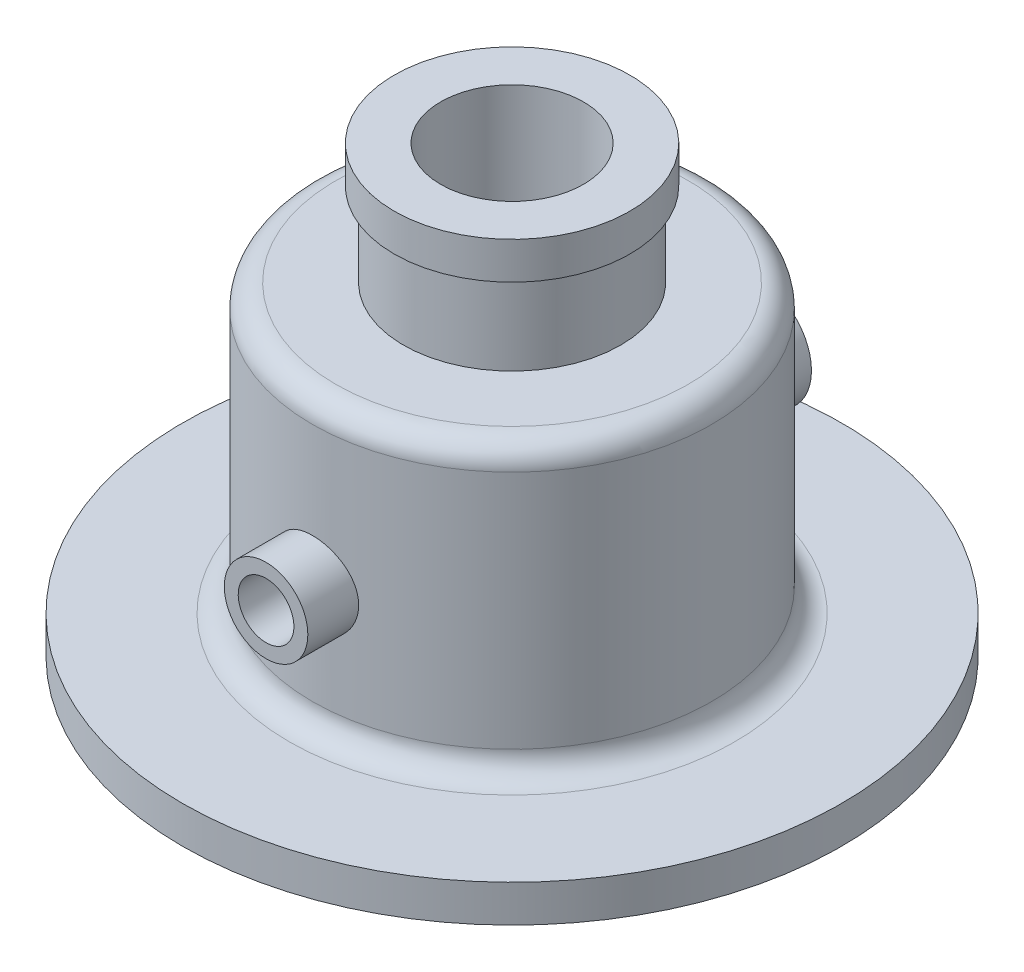
from build123d import *
from build123d.topology import SkipClean

# Parameters (mm, degrees)
CROQUIS2_R              = 71
CROQUIS2_R_2            = 25
SALIENTE_EXTRUIR2_DEPTH = 8
CROQUIS6_R              = 32
CROQUIS6_R_2            = 25
SALIENTE_EXTRUIR3_DEPTH = 18
REDONDEO1_R             = 2
CROQUIS7_R              = 43
CROQUIS7_R_2            = 35
EXTRUIR_L_MINA2_DEPTH   = 61.7
REDONDEO2_R             = 5
SALIENTE_EXTRUIR6_START = -8
CROQUIS16_R             = 43
SALIENTE_EXTRUIR6_DEPTH = 8
REDONDEO4_R             = 5
CROQUIS17_R             = 23.4
CROQUIS17_R_2           = 15.4
EXTRUIR_L_MINA3_DEPTH   = 18
CROQUIS18_R             = 25.4
SALIENTE_EXTRUIR7_DEPTH = 8
CROQUIS19_R             = 15.4
CORTAR_EXTRUIR3_DEPTH   = 60
CROQUIS20_W             = 75.22649233
CROQUIS20_H             = 104.996756407
CORTAR_EXTRUIR4_DEPTH   = 75
REDONDEO6_R             = 5
REVOLUCI_N4_ANGLE       = 180
SALIENTE_EXTRUIR8_DEPTH = 13
CORTAR_EXTRUIR5_DEPTH   = 6.5
SALIENTE_EXTRUIR9_DEPTH = 13
CROQUIS27_R             = 6
CORTAR_EXTRUIR7_DEPTH   = 6.5


with BuildPart() as part:
    # Croquis2 → Saliente-Extruir2 (new body)
    with BuildSketch(Plane(origin=(0, 0, 0), x_dir=(1, 0, 0), z_dir=(0, 1, 0))):
        with Locations(Location((0, 0, 0), (0, 0, 270))):
            Circle(CROQUIS2_R)
        with Locations(Location((0, 0, 0), (0, 0, 270))):
            Circle(CROQUIS2_R_2, mode=Mode.SUBTRACT)
    extrude(amount=SALIENTE_EXTRUIR2_DEPTH)

    # Croquis6 → Saliente-Extruir3 (add)
    with BuildSketch(Plane(origin=(0, -5, 0), x_dir=(1, 0, 0), z_dir=(0, 1, 0))):
        with Locations(Location((0, 0, 0), (0, 0, 270))):
            Circle(CROQUIS6_R)
        with Locations(Location((0, 0, 0), (0, 0, 270))):
            Circle(CROQUIS6_R_2, mode=Mode.SUBTRACT)
    extrude(amount=SALIENTE_EXTRUIR3_DEPTH)

    # Redondeo1
    redondeo1_edges = [part.edges().sort_by_distance(p)[0] for p in [
        (0, 0, -32),
    ]]
    fillet(redondeo1_edges, radius=REDONDEO1_R)

    # Croquis7 → Extruir-Lámina2 (add)
    with BuildSketch(Plane(origin=(0, 8, 0), x_dir=(1, 0, 0), z_dir=(0, 1, 0))):
        Circle(CROQUIS7_R)
        Circle(CROQUIS7_R_2, mode=Mode.SUBTRACT)
    extrude(amount=EXTRUIR_L_MINA2_DEPTH)

    # Redondeo2
    redondeo2_edges = [part.edges().sort_by_distance(p)[0] for p in [
        (-43, 8, 0),
    ]]
    fillet(redondeo2_edges, radius=REDONDEO2_R)

    # Redondeo3: read off the stored shape, not the designer's step
    # Redondeo3 outline → Redondeo3 (revolve)
    with BuildSketch(Plane.XY):
        with BuildLine():
            Line((30, 13), (32, 13))
            Line((32, 13), (32, 8))
            Line((32, 8), (35, 8))
            Line((35, 8), (35, 18))
            ThreePointArc((35, 18), (33.535533906, 14.464466094), (30, 13))
        make_face()
    revolve(axis=Axis((0, 0, 0), (0, 1, 0)))

    # Croquis16 → Saliente-Extruir6 (add)
    with BuildSketch(Plane(origin=(0, 69.7, 0), x_dir=(1, 0, 0), z_dir=(0, 1, 0)).offset(SALIENTE_EXTRUIR6_START)):
        Circle(CROQUIS16_R)
    extrude(amount=SALIENTE_EXTRUIR6_DEPTH)

    # Redondeo4
    redondeo4_edges = [part.edges().sort_by_distance(p)[0] for p in [
        (-43, 69.7, 0),
    ]]
    fillet(redondeo4_edges, radius=REDONDEO4_R)

    # Croquis17 → Extruir-Lámina3 (add)
    with BuildSketch(Plane(origin=(0, 69.7, 0), x_dir=(1, 0, 0), z_dir=(0, 1, 0))):
        Circle(CROQUIS17_R)
        Circle(CROQUIS17_R_2, mode=Mode.SUBTRACT)
    extrude(amount=EXTRUIR_L_MINA3_DEPTH)

    # Croquis18 → Saliente-Extruir7 (add)
    with BuildSketch(Plane(origin=(0, 87.7, 0), x_dir=(1, 0, 0), z_dir=(0, 1, 0))):
        with Locations(Location((0, 0, 0), (0, 0, 270))):
            Circle(CROQUIS18_R)
    extrude(amount=SALIENTE_EXTRUIR7_DEPTH)

    # Croquis19 → Cortar-Extruir3 (cut, symmetric)
    with SkipClean():  # the faces are left unmerged after this step: merging them gives an invalid solid
        with BuildSketch(Plane(origin=(0, 95.7, 0), x_dir=(1, 0, 0), z_dir=(0, 1, 0))):
            with Locations(Location((0, 0, 0), (0, 0, 270))):
                Circle(CROQUIS19_R)
        extrude(amount=CORTAR_EXTRUIR3_DEPTH, both=True, mode=Mode.SUBTRACT)

    # Croquis20 → Cortar-Extruir4 (cut, symmetric)
    with BuildSketch(Plane.XY):
        with Locations((37.613246165, 47.498378204)):
            Rectangle(CROQUIS20_W, CROQUIS20_H)
    extrude(amount=CORTAR_EXTRUIR4_DEPTH, both=True, mode=Mode.SUBTRACT)

    # Redondeo6
    redondeo6_edges = [part.edges().sort_by_distance(p)[0] for p in [
        (-35, 61.7, 0),
    ]]
    fillet(redondeo6_edges, radius=REDONDEO6_R)

    # Croquis21 → Revolución4 (revolve)
    with BuildSketch(Plane(origin=(0, 0, 0), x_dir=(0, 0, -1), z_dir=(1, 0, 0))):
        Polygon((-15.4, 61.7), (-17.4, 59.7), (-25.4, 59.7), (-25.4, 61.7), align=None)
    revolve(axis=Axis((0, 0, 0), (0, -1, 0)), revolution_arc=REVOLUCI_N4_ANGLE)

    # Croquis22 → Saliente-Extruir8 (add)
    with BuildSketch(Plane.XY.offset(-40)):
        with BuildLine():
            Line((0, 44), (0, 40))
            ThreePointArc((0, 40), (-7.5, 32.5), (0, 25))
            Line((0, 25), (0, 21))
            ThreePointArc((0, 21), (-11.5, 32.5), (0, 44))
        make_face()
    extrude(amount=-SALIENTE_EXTRUIR8_DEPTH)

    # Croquis24 → Cortar-Extruir5 (cut, symmetric)
    with BuildSketch(Plane.XY.offset(-40)):
        with BuildLine():
            Line((0, 40), (0, 25))
            ThreePointArc((0, 25), (-7.5, 32.5), (0, 40))
        make_face()
    extrude(amount=CORTAR_EXTRUIR5_DEPTH, both=True, mode=Mode.SUBTRACT)

    # Croquis25 → Saliente-Extruir9 (add)
    with BuildSketch(Plane.XY.offset(40)):
        with BuildLine():
            Line((0, 44), (0, 41))
            ThreePointArc((0, 41), (-6, 35), (0, 29))
            Line((0, 29), (0, 26))
            ThreePointArc((0, 26), (-9, 35), (0, 44))
        make_face()
    extrude(amount=SALIENTE_EXTRUIR9_DEPTH)

    # Croquis27 → Cortar-Extruir7 (cut, symmetric)
    with BuildSketch(Plane.XY.offset(40)):
        with Locations((0, 35)):
            Circle(CROQUIS27_R)
    extrude(amount=CORTAR_EXTRUIR7_DEPTH, both=True, mode=Mode.SUBTRACT)

    # Simetría1: part across plane


with BuildPart() as part_1:
    with SkipClean():  # the faces are left unmerged after this step: merging them gives an invalid solid
        add(part.part)
        add(part.part.mirror(Plane(origin=(0, 0, 0), x_dir=(0, 0, 1), z_dir=(1, 0, 0))))


solid = part_1.part
